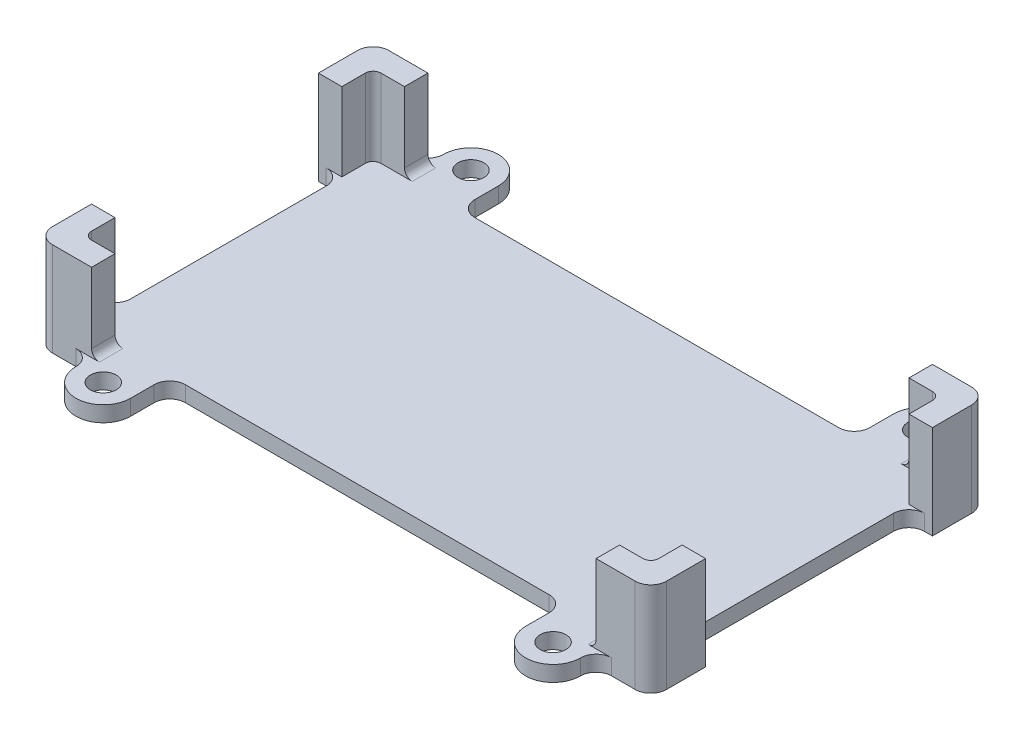
from build123d import *

# Parameters (mm, degrees)
SKETCH_1_W           = 72.5
SKETCH_1_H           = 37
EXTRUDE_1_DEPTH      = 2
EXTRUDE_2_DEPTH      = 10
EXTRUDE_2_DEPTH_BACK = 2
SKETCH_3_R           = 1.65
EXTRUDE_3_DEPTH      = 2
FILLET_1_R           = 2
FILLET_2_R           = 1


with BuildPart() as part:
    # 草图1 → 凸台-拉伸1 (new body)
    with BuildSketch(Plane(origin=(0, 0, 0), x_dir=(1, 0, 0), z_dir=(0, 1, 0))):
        Rectangle(SKETCH_1_W, SKETCH_1_H)
    extrude(amount=EXTRUDE_1_DEPTH)

    # 草图2 → 凸台-拉伸2 (add, two sides: drawn at the far end of the back side and taken through both)
    with BuildSketch(Plane(origin=(0, 2, 0), x_dir=(1, 0, 0), z_dir=(0, 1, 0)).offset(-EXTRUDE_2_DEPTH_BACK)):
        Polygon((-36.25, 18.5), (-36.25, 14.5), (-39.25, 14.5), (-39.25, 21.5), (-32.25, 21.5), (-32.25, 18.5), align=None)
        Polygon((32.25, 18.5), (36.25, 18.5), (36.25, 14.5), (39.25, 14.5), (39.25, 21.5), (32.25, 21.5), align=None)
        Polygon((36.25, -18.5), (36.25, -14.5), (39.25, -14.5), (39.25, -21.5), (32.25, -21.5), (32.25, -18.5), align=None)
        Polygon((-32.25, -18.5), (-36.25, -18.5), (-36.25, -14.5), (-39.25, -14.5), (-39.25, -21.5), (-32.25, -21.5), align=None)
    extrude(amount=EXTRUDE_2_DEPTH + EXTRUDE_2_DEPTH_BACK)

    # 草图3 → 凸台-拉伸3 (add)
    # profile 1 of 4: a face of its own
    with BuildSketch(Plane(origin=(0, 2, 0), x_dir=(1, 0, 0), z_dir=(0, 1, 0))):
        with BuildLine():
            Line((25.25, 18.5), (25.25, 23.5))
            ThreePointArc((25.25, 23.5), (28.75, 27), (32.25, 23.5))
            Line((32.25, 23.5), (32.25, 18.5))
            Line((32.25, 18.5), (25.25, 18.5))
        make_face()
        with Locations(Location((28.75, 23.5, 0), (0, 0, 90))):
            Circle(SKETCH_3_R, mode=Mode.SUBTRACT)
    # profile 2 of 4: a face of its own
    with BuildSketch(Plane(origin=(0, 2, 0), x_dir=(1, 0, 0), z_dir=(0, 1, 0))):
        with BuildLine():
            Line((-32.25, 18.5), (-25.25, 18.5))
            Line((-25.25, 18.5), (-25.25, 23.5))
            ThreePointArc((-25.25, 23.5), (-28.75, 27), (-32.25, 23.5))
            Line((-32.25, 23.5), (-32.25, 18.5))
        make_face()
        with Locations(Location((-28.75, 23.5, 0), (0, 0, 270))):
            Circle(SKETCH_3_R, mode=Mode.SUBTRACT)
    # profile 3 of 4: a face of its own
    with BuildSketch(Plane(origin=(0, 2, 0), x_dir=(1, 0, 0), z_dir=(0, 1, 0))):
        with BuildLine():
            Line((32.25, -18.5), (25.25, -18.5))
            Line((25.25, -18.5), (25.25, -23.5))
            ThreePointArc((25.25, -23.5), (28.75, -27), (32.25, -23.5))
            Line((32.25, -23.5), (32.25, -18.5))
        make_face()
        with Locations(Location((28.75, -23.5, 0), (0, 0, 270))):
            Circle(SKETCH_3_R, mode=Mode.SUBTRACT)
    # profile 4 of 4: a face of its own
    with BuildSketch(Plane(origin=(0, 2, 0), x_dir=(1, 0, 0), z_dir=(0, 1, 0))):
        with BuildLine():
            Line((-25.25, -18.5), (-25.25, -23.5))
            ThreePointArc((-25.25, -23.5), (-28.75, -27), (-32.25, -23.5))
            Line((-32.25, -23.5), (-32.25, -18.5))
            Line((-32.25, -18.5), (-25.25, -18.5))
        make_face()
        with Locations(Location((-28.75, -23.5, 0), (0, 0, 90))):
            Circle(SKETCH_3_R, mode=Mode.SUBTRACT)
    extrude(amount=-EXTRUDE_3_DEPTH)

    # 圆角1
    fillet_1_edges = [part.edges().sort_by_distance(p)[0] for p in [
        (-25.25, 1, 18.5),
        (-36.25, 1, 14.5),
        (-36.25, 1, -14.5),
        (-25.25, 1, -18.5),
        (25.25, 1, -18.5),
        (36.25, 1, -14.5),
        (36.25, 1, 14.5),
        (-39.25, 6, 21.5),
        (39.25, 6, 21.5),
        (39.25, 6, -21.5),
        (-39.25, 6, -21.5),
        (-32.25, 1, -21.5),
        (32.25, 1, -21.5),
        (25.25, 1, 18.5),
        (32.25, 1, 21.5),
        (-32.25, 1, 21.5),
    ]]
    fillet(fillet_1_edges, radius=FILLET_1_R - 0.0001)  # a hair under: the kernel refuses the full size

    # 圆角2
    fillet_2_edges = [part.edges().sort_by_distance(p)[0] for p in [
        (-32.25, 2, 20),
        (32.25, 2, -20),
        (-36.25, 7, 18.5),
        (36.25, 7, 18.5),
        (36.25, 7, -18.5),
        (-36.25, 7, -18.5),
        (32.25, 2, 20),
        (-32.25, 2, -20),
    ]]
    fillet(fillet_2_edges, radius=FILLET_2_R)


solid = part.part
